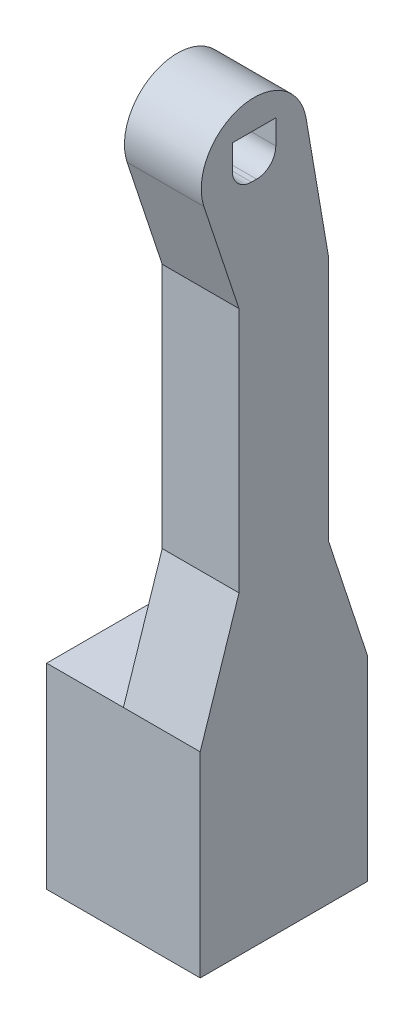
from build123d import *

# Parameters (mm, degrees)
BOSS_EXTRUDE2_DEPTH = 6
BOSS_EXTRUDE3_DEPTH = 6


with BuildPart() as part:
    # Sketch1 → Boss-Extrude2 (new body)
    with BuildSketch(Plane(origin=(0, 0, 0), x_dir=(0, 0, -1), z_dir=(1, 0, 0))):
        Polygon((-6.530112864, 15.3052734), (-6.530112864, 0), (-3, 0), (-3, 9.82), (3, 9.82), (3, 0), (6.530112864, 0), (6.530112864, 15.3052734), align=None)
    extrude(amount=-BOSS_EXTRUDE2_DEPTH)

    # Sketch1<4> → Boss-Extrude3 (add)
    with BuildSketch(Plane(origin=(0, 0, 0), x_dir=(0, 0, -1), z_dir=(1, 0, 0))):
        with BuildLine():
            Line((6.530112864, 0), (6.530112864, 15.3052734))
            Line((6.530112864, 15.3052734), (3.498344074, 24.541666174))
            Line((3.498344074, 24.541666174), (3.498344074, 43.778718631))
            Line((3.498344074, 43.778718631), (1.742466173, 54.048264378))
            ThreePointArc((1.742466173, 54.048264378), (-3.323802498, 57.355930134), (-6.240866628, 52.055131338))
            Line((-6.240866628, 52.055131338), (-3.498344074, 43.778718631))
            Line((-3.498344074, 43.778718631), (-3.498344074, 24.541666174))
            Line((-3.498344074, 24.541666174), (-6.530112864, 15.3052734))
            Line((-6.530112864, 15.3052734), (-6.530112864, 0))
            Line((-6.530112864, 0), (6.530112864, 0))
        make_face()
        with BuildLine():
            Line((-0.624402568, 55.252914737), (-0.624402568, 53.352914737))
            ThreePointArc((-0.624402568, 53.352914737), (-1.063742396, 52.292254566), (-2.124402568, 51.852914737))
            Line((-2.124402568, 51.852914737), (-2.524402568, 51.852914737))
            ThreePointArc((-2.524402568, 51.852914737), (-3.58506274, 52.292254566), (-4.024402568, 53.352914737))
            Line((-4.024402568, 53.352914737), (-4.024402568, 55.252914737))
            Line((-4.024402568, 55.252914737), (-0.624402568, 55.252914737))
        make_face(mode=Mode.SUBTRACT)
    extrude(amount=BOSS_EXTRUDE3_DEPTH)


solid = part.part
